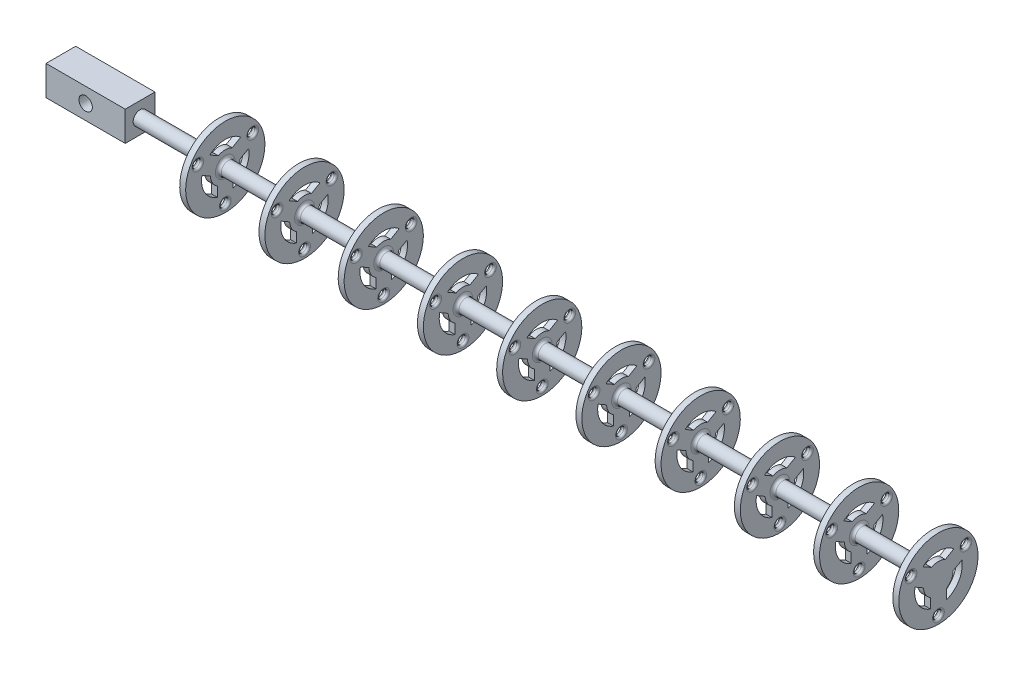
from build123d import *

# Parameters (mm, degrees)
SKETCH2_W                      = 200
SKETCH2_H                      = 1.75
SKETCH3_W                      = 1.5
SKETCH3_H                      = 10
CUT_EXTRUDE1_REACH             = 181.059
SKETCH5_R                      = 1
FILLET1_R                      = 0.5
LPATTERN1_COUNT                = 10
LPATTERN1_PITCH                = 20
FILLET1_OF_LPATTERN1_R         = 0.5
SKETCH16_W                     = 7.5
SKETCH16_H                     = 7.5
BOSS_EXTRUDE1_DEPTH            = 20
M3_CLEARANCE_HOLE1_D           = 3.4
M3_CLEARANCE_HOLE1_CSINK_D     = 3.45
M3_CLEARANCE_HOLE1_CSINK_ANGLE = 90
FILLET2_R                      = 0.75


with BuildPart() as part:
    # Sketch2 → Revolve1 (revolve)
    with BuildSketch(Plane.XY):
        with Locations((100, 0.875)):
            Rectangle(SKETCH2_W, SKETCH2_H)
    revolve(axis=Axis((200, 0, 0), (-1, 0, 0)))

    # Sketch3 → Revolve2 (revolve)
    with BuildSketch(Plane.XY):
        with Locations((20.75, 5)):
            Rectangle(SKETCH3_W, SKETCH3_H)
    revolve2 = revolve(axis=Axis((21.5, 0, 0), (-1, 0, 0)))

    # Sketch5 → Cut-Extrude1 (cut, up to next)
    with BuildSketch(Plane(origin=(21.5, 0, 0), x_dir=(0, 0, -1), z_dir=(1, 0, 0)), mode=Mode.PRIVATE) as cut_extrude1_sk1:
        with Locations((0, -8)):
            Circle(SKETCH5_R)
    cut_extrude1_tool1 = extrude(cut_extrude1_sk1.sketch, amount=-CUT_EXTRUDE1_REACH, mode=Mode.PRIVATE) & part.part
    # Sketch5 → Cut-Extrude1 (cut, up to next)
    with BuildSketch(Plane(origin=(21.5, 0, 0), x_dir=(0, 0, -1), z_dir=(1, 0, 0)), mode=Mode.PRIVATE) as cut_extrude1_sk2:
        with Locations((6.92820323, 4)):
            Circle(SKETCH5_R)
    cut_extrude1_tool2 = extrude(cut_extrude1_sk2.sketch, amount=-CUT_EXTRUDE1_REACH, mode=Mode.PRIVATE) & part.part
    # Sketch5 → Cut-Extrude1 (cut, up to next)
    with BuildSketch(Plane(origin=(21.5, 0, 0), x_dir=(0, 0, -1), z_dir=(1, 0, 0)), mode=Mode.PRIVATE) as cut_extrude1_sk3:
        with Locations((-6.92820323, 4)):
            Circle(SKETCH5_R)
    cut_extrude1_tool3 = extrude(cut_extrude1_sk3.sketch, amount=-CUT_EXTRUDE1_REACH, mode=Mode.PRIVATE) & part.part
    # Sketch5 → Cut-Extrude1 (cut, up to next)
    with BuildSketch(Plane(origin=(21.5, 0, 0), x_dir=(0, 0, -1), z_dir=(1, 0, 0)), mode=Mode.PRIVATE) as cut_extrude1_sk4:
        with BuildLine():
            Line((-3.898979486, 4.560477932), (-1.747157622, 3.318123))
            ThreePointArc((-1.747157622, 3.318123), (0, 3.75), (1.747157622, 3.318123))
            Line((1.747157622, 3.318123), (3.898979486, 4.560477932))
            ThreePointArc((3.898979486, 4.560477932), (0, 6), (-3.898979486, 4.560477932))
        make_face()
    cut_extrude1_tool4 = extrude(cut_extrude1_sk4.sketch, amount=-CUT_EXTRUDE1_REACH, mode=Mode.PRIVATE) & part.part
    # Sketch5 → Cut-Extrude1 (cut, up to next)
    with BuildSketch(Plane(origin=(21.5, 0, 0), x_dir=(0, 0, -1), z_dir=(1, 0, 0)), mode=Mode.PRIVATE) as cut_extrude1_sk5:
        with BuildLine():
            Line((2, -3.172144385), (2, -5.656854249))
            ThreePointArc((2, -5.656854249), (5.196152423, -3), (5.898979486, 1.096376317))
            Line((5.898979486, 1.096376317), (3.747157622, -0.145978615))
            ThreePointArc((3.747157622, -0.145978615), (3.247595264, -1.875), (2, -3.172144385))
        make_face()
    cut_extrude1_tool5 = extrude(cut_extrude1_sk5.sketch, amount=-CUT_EXTRUDE1_REACH, mode=Mode.PRIVATE) & part.part
    # Sketch5 → Cut-Extrude1 (cut, up to next)
    with BuildSketch(Plane(origin=(21.5, 0, 0), x_dir=(0, 0, -1), z_dir=(1, 0, 0)), mode=Mode.PRIVATE) as cut_extrude1_sk6:
        with BuildLine():
            Line((-3.747157622, -0.145978615), (-5.898979486, 1.096376317))
            ThreePointArc((-5.898979486, 1.096376317), (-5.196152423, -3), (-2, -5.656854249))
            Line((-2, -5.656854249), (-2, -3.172144385))
            ThreePointArc((-2, -3.172144385), (-3.247595264, -1.875), (-3.747157622, -0.145978615))
        make_face()
    cut_extrude1_tool6 = extrude(cut_extrude1_sk6.sketch, amount=-CUT_EXTRUDE1_REACH, mode=Mode.PRIVATE) & part.part
    cut_extrude1_1 = cut_extrude1_tool1.solids().sort_by_distance((21.5, -8, 0))[0]
    add(cut_extrude1_1, mode=Mode.SUBTRACT)
    cut_extrude1_2 = cut_extrude1_tool2.solids().sort_by_distance((21.5, 4, -6.928203))[0]
    add(cut_extrude1_2, mode=Mode.SUBTRACT)
    cut_extrude1_3 = cut_extrude1_tool3.solids().sort_by_distance((21.5, 4, 6.928203))[0]
    add(cut_extrude1_3, mode=Mode.SUBTRACT)
    cut_extrude1_4 = cut_extrude1_tool4.solids().sort_by_distance((21.5, 4.688973, 0))[0]
    add(cut_extrude1_4, mode=Mode.SUBTRACT)
    cut_extrude1_5 = cut_extrude1_tool5.solids().sort_by_distance((21.5, -2.344486, -4.06077))[0]
    add(cut_extrude1_5, mode=Mode.SUBTRACT)
    cut_extrude1_6 = cut_extrude1_tool6.solids().sort_by_distance((21.5, -2.344486, 4.06077))[0]
    add(cut_extrude1_6, mode=Mode.SUBTRACT)
    cut_extrude1 = cut_extrude1_1 + cut_extrude1_2 + cut_extrude1_3 + cut_extrude1_4 + cut_extrude1_5 + cut_extrude1_6  # Cut-Extrude1 as one shape, for the pattern or mirror that repeats it

    # Fillet1
    fillet1_edges = [part.edges().sort_by_distance(p)[0] for p in [
        (20, 4, -5.92820323),
        (20, -8, 1),
        (21.5, -8, 1),
        (21.5, 4, -5.92820323),
        (20, 4, 7.92820323),
        (21.5, 4, 7.92820323),
    ]]
    fillet(fillet1_edges, radius=FILLET1_R)

    # LPattern1: Revolve2, Cut-Extrude1 ×10
    with Locations(*[(i * LPATTERN1_PITCH, 0, 0) for i in range(1, LPATTERN1_COUNT)]):
        add(revolve2)
        add(cut_extrude1, mode=Mode.SUBTRACT)

    # Fillet1 of LPattern1
    fillet1_of_lpattern1_edges = [part.edges().sort_by_distance(p)[0] for p in [
        (40, 4, -5.92820323),
        (40, -8, 1),
        (41.5, -8, 1),
        (41.5, 4, -5.92820323),
        (40, 4, 7.92820323),
        (41.5, 4, 7.92820323),
        (60, 4, -5.92820323),
        (60, -8, 1),
        (61.5, -8, 1),
        (61.5, 4, -5.92820323),
        (60, 4, 7.92820323),
        (61.5, 4, 7.92820323),
        (80, 4, -5.92820323),
        (80, -8, 1),
        (81.5, -8, 1),
        (81.5, 4, -5.92820323),
        (80, 4, 7.92820323),
        (81.5, 4, 7.92820323),
        (100, 4, -5.92820323),
        (100, -8, 1),
        (101.5, -8, 1),
        (101.5, 4, -5.92820323),
        (100, 4, 7.92820323),
        (101.5, 4, 7.92820323),
        (120, 4, -5.92820323),
        (120, -8, 1),
        (121.5, -8, 1),
        (121.5, 4, -5.92820323),
        (120, 4, 7.92820323),
        (121.5, 4, 7.92820323),
        (140, 4, -5.92820323),
        (140, -8, 1),
        (141.5, -8, 1),
        (141.5, 4, -5.92820323),
        (140, 4, 7.92820323),
        (141.5, 4, 7.92820323),
        (160, 4, -5.92820323),
        (160, -8, 1),
        (161.5, -8, 1),
        (161.5, 4, -5.92820323),
        (160, 4, 7.92820323),
        (161.5, 4, 7.92820323),
        (180, 4, -5.92820323),
        (180, -8, 1),
        (181.5, -8, 1),
        (181.5, 4, -5.92820323),
        (180, 4, 7.92820323),
        (181.5, 4, 7.92820323),
        (200, 4, -5.92820323),
        (200, -8, 1),
        (201.5, -8, 1),
        (201.5, 4, -5.92820323),
        (200, 4, 7.92820323),
        (201.5, 4, 7.92820323),
    ]]
    fillet(fillet1_of_lpattern1_edges, radius=FILLET1_OF_LPATTERN1_R)

    # Sketch16 → Boss-Extrude1 (add)
    with BuildSketch(Plane.ZY):
        Rectangle(SKETCH16_W, SKETCH16_H)
    extrude(amount=BOSS_EXTRUDE1_DEPTH)

    # M3 Clearance Hole1 (through all)
    with Locations(Plane(origin=(0, 0, -3.75), x_dir=(-1, 0, 0), z_dir=(0, 0, -1))):
        with Locations((10, 0)):
            CounterSinkHole(M3_CLEARANCE_HOLE1_D / 2, M3_CLEARANCE_HOLE1_CSINK_D / 2, counter_sink_angle=M3_CLEARANCE_HOLE1_CSINK_ANGLE)

    # Fillet2
    fillet2_edges = [part.edges().sort_by_distance(p)[0] for p in [
        (20, -1.75, 0),
        (21.5, -1.75, 0),
        (40, -1.75, 0),
        (41.5, -1.75, 0),
        (60, -1.75, 0),
        (61.5, -1.75, 0),
        (80, -1.75, 0),
        (81.5, -1.75, 0),
        (100, -1.75, 0),
        (101.5, -1.75, 0),
        (120, -1.75, 0),
        (121.5, -1.75, 0),
        (140, -1.75, 0),
        (141.5, -1.75, 0),
        (160, -1.75, 0),
        (161.5, -1.75, 0),
        (180, -1.75, 0),
        (181.5, -1.75, 0),
        (200, -1.75, 0),
    ]]
    fillet(fillet2_edges, radius=FILLET2_R)


solid = part.part
